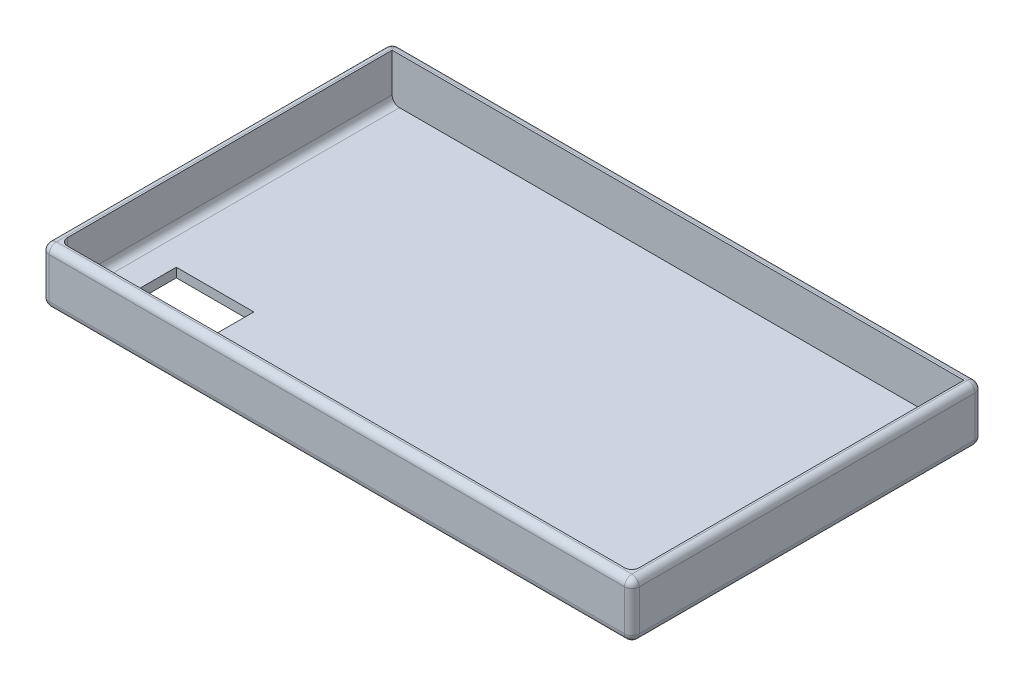
from build123d import *

# Parameters (mm, degrees)
SKETCH1_W           = 160
SKETCH1_H           = 95
BOSS_EXTRUDE1_DEPTH = 15
SHELL1_T            = -2.5
SKETCH2_W           = 21
SKETCH2_H           = 13
CUT_EXTRUDE1_DEPTH  = 15
FILLET2_R           = 2
FILLET8_R           = 2
FILLET13_R          = 2


with BuildPart() as part:
    # Sketch1 → Boss-Extrude1 (new body)
    with BuildSketch(Plane(origin=(0, 0, 0), x_dir=(1, 0, 0), z_dir=(0, 1, 0))):
        with Locations((5.685950413, -3.070247934)):
            Rectangle(SKETCH1_W, SKETCH1_H)
    extrude(amount=BOSS_EXTRUDE1_DEPTH)

    # Shell1
    shell1_openings = [part.faces().sort_by_distance(p)[0] for p in [
        (5.685950413, 15, 3.070247934),
    ]]
    offset(amount=SHELL1_T, openings=shell1_openings, kind=Kind.INTERSECTION)

    # Sketch2 → Cut-Extrude1 (cut)
    with BuildSketch(Plane(origin=(0, 0, 0), x_dir=(1, 0, 0), z_dir=(0, 1, 0))):
        with Locations((-52.103761913, -32.277000916)):
            Rectangle(SKETCH2_W, SKETCH2_H)
    extrude(amount=CUT_EXTRUDE1_DEPTH, mode=Mode.SUBTRACT)

    # Fillet2
    fillet2_edges = [part.edges().sort_by_distance(p)[0] for p in [
        (5.685950413, 15, -44.429752066),
        (-74.314049587, 15, 3.070247934),
        (5.685950413, 0, -44.429752066),
        (85.685950413, 0, 3.070247934),
        (5.685950413, 0, 50.570247934),
        (-74.314049587, 0, 3.070247934),
        (-74.314049587, 7.5, -44.429752066),
        (85.685950413, 7.5, -44.429752066),
        (-74.314049587, 7.5, 50.570247934),
    ]]
    fillet(fillet2_edges, radius=FILLET2_R)

    # Fillet8
    # the kernel refuses this fillet: 2 mm, written as the material it adds along each edge
    with BuildSketch(Plane(origin=(-71.814049587, 2.5, -41.929752066), x_dir=(0, 1, 0), z_dir=(0, 0, 1))) as fillet8_piece_1:
        with BuildLine():
            CenterArc((FILLET8_R, -FILLET8_R), FILLET8_R, 90, 90)
            Line((0, -FILLET8_R), (0, 0))
            Line((0, 0), (FILLET8_R, 0))
        make_face()
    extrude(amount=90)
    # the kernel refuses this fillet: 2 mm, written as the material it takes off along each edge
    with BuildSketch(Plane(origin=(83.685950413, 13, -42.429752066), x_dir=(1, 0, 0), z_dir=(0, 1, 0))) as fillet8_2_piece_1_section:
        Polygon((0, 0), (FILLET8_R * 1.02, 0), (FILLET8_R * 1.02, FILLET8_R * 1.02), (0, FILLET8_R * 1.02), align=None)
    fillet8_2_piece_1 = extrude(amount=FILLET8_R * 1.02, mode=Mode.PRIVATE)
    fillet8_2_piece_1 = fillet8_2_piece_1 - Plane(origin=(83.685950413, 13, -42.429752066), x_dir=(-0.7071067811865476, 0, 0.7071067811865475), z_dir=(0, 1, 0)) * Sphere(FILLET8_R, mode=Mode.PRIVATE)
    add(fillet8_2_piece_1, mode=Mode.SUBTRACT)
    with BuildSketch(Plane(origin=(83.685950413, 2, 48.570247934), x_dir=(0, 0, 1), z_dir=(1, 0, 0))) as fillet8_2_piece_2_section:
        Polygon((0, 0), (FILLET8_R * 1.02, 0), (FILLET8_R * 1.02, FILLET8_R * 1.02), (0, FILLET8_R * 1.02), align=None)
    fillet8_2_piece_2 = extrude(amount=FILLET8_R * 1.02, mode=Mode.PRIVATE)
    fillet8_2_piece_2 = fillet8_2_piece_2 - Plane(origin=(83.685950413, 2, 48.570247934), x_dir=(0, 0.7071067811865475, -0.7071067811865475), z_dir=(1, 0, 0)) * Sphere(FILLET8_R, mode=Mode.PRIVATE)
    add(fillet8_2_piece_2, mode=Mode.SUBTRACT)
    with BuildSketch(Plane(origin=(-72.314049587, 13, 48.570247934), x_dir=(0, 0, 1), z_dir=(0, 1, 0))) as fillet8_2_piece_3_section:
        Polygon((0, 0), (FILLET8_R * 1.02, 0), (FILLET8_R * 1.02, -FILLET8_R * 1.02), (0, -FILLET8_R * 1.02), align=None)
    fillet8_2_piece_3 = extrude(amount=FILLET8_R * 1.02, mode=Mode.PRIVATE)
    fillet8_2_piece_3 = fillet8_2_piece_3 - Plane(origin=(-72.314049587, 13, 48.570247934), x_dir=(0.7071067811865475, 0, -0.7071067811865475), z_dir=(0, 1, 0)) * Sphere(FILLET8_R, mode=Mode.PRIVATE)
    add(fillet8_2_piece_3, mode=Mode.SUBTRACT)
    with BuildSketch(Plane(origin=(83.685950413, 13, 48.570247934), x_dir=(0, 0, 1), z_dir=(1, 0, 0))) as fillet8_2_piece_4_section:
        Polygon((0, 0), (FILLET8_R * 1.02, 0), (FILLET8_R * 1.02, -FILLET8_R * 1.02), (0, -FILLET8_R * 1.02), align=None)
    fillet8_2_piece_4 = extrude(amount=FILLET8_R * 1.02, mode=Mode.PRIVATE)
    fillet8_2_piece_4 = fillet8_2_piece_4 - Plane(origin=(83.685950413, 13, 48.570247934), x_dir=(0, -0.7071067811865475, -0.7071067811865475), z_dir=(1, 0, 0)) * Sphere(FILLET8_R, mode=Mode.PRIVATE)
    add(fillet8_2_piece_4, mode=Mode.SUBTRACT)
    with BuildSketch(Plane(origin=(85.685950413, 15, -42.429752066), x_dir=(-1, 0, 0), z_dir=(0, 0, 1))) as fillet8_2_piece_5:
        with BuildLine():
            CenterArc((FILLET8_R, FILLET8_R), FILLET8_R, 180, 90)
            Line((0, FILLET8_R), (0, 0))
            Line((0, 0), (FILLET8_R, 0))
        make_face()
    extrude(amount=91, mode=Mode.SUBTRACT)
    with BuildSketch(Plane(origin=(83.685950413, 15, 50.570247934), x_dir=(0, 0, -1), z_dir=(-1, 0, 0))) as fillet8_2_piece_6:
        with BuildLine():
            CenterArc((FILLET8_R, FILLET8_R), FILLET8_R, 180, 90)
            Line((0, FILLET8_R), (0, 0))
            Line((0, 0), (FILLET8_R, 0))
        make_face()
    extrude(amount=156, mode=Mode.SUBTRACT)
    with BuildSketch(Plane(origin=(85.685950413, 2, 50.570247934), x_dir=(0, 0, -1), z_dir=(0, 1, 0))) as fillet8_2_piece_7:
        with BuildLine():
            CenterArc((FILLET8_R, FILLET8_R), FILLET8_R, 180, 90)
            Line((0, FILLET8_R), (0, 0))
            Line((0, 0), (FILLET8_R, 0))
        make_face()
    extrude(amount=11, mode=Mode.SUBTRACT)

    # Fillet13
    fillet13_edges = [part.edges().sort_by_distance(p)[0] for p in [
        (-71.814049587, 9.75, 48.070247934),
        (83.185950413, 2.5, 3.070247934),
        (83.185950413, 8.75, 48.070247934),
        (6.685950413, 2.5, 48.070247934),
        (-71.228263149, 3.085786438, 48.070247934),
    ]]
    fillet(fillet13_edges, radius=FILLET13_R)


solid = part.part
